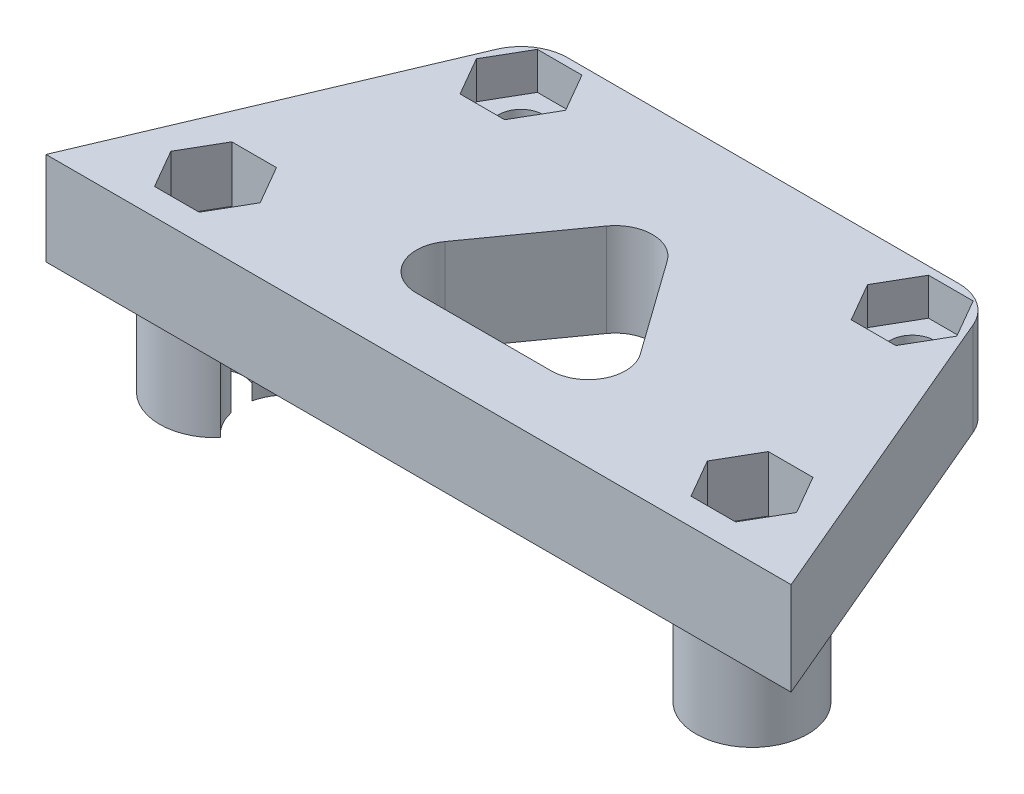
from build123d import *

# Parameters (mm, degrees)
SKETCH1_R            = 1.5
BOSS_EXTRUDE1_DEPTH  = 5
M2_CLEARANCE_HOLE1_D = 2.4
FILLET1_R            = 2
BOSS_EXTRUDE2_START  = 5
BOSS_EXTRUDE2_DEPTH  = 5
CUT_EXTRUDE1_START   = -3
SKETCH5_R            = 1.5
CUT_EXTRUDE1_DEPTH   = 3
CUT_EXTRUDE2_START   = -2
SKETCH6_R            = 1.2
CUT_EXTRUDE2_DEPTH   = 2


with BuildPart() as part:
    # Sketch1 → Boss-Extrude1 (new body)
    with BuildSketch(Plane(origin=(0, 0, 0), x_dir=(1, 0, 0), z_dir=(0, 1, 0))):
        with BuildLine():
            Line((10.5, 2.5), (-10.5, 2.5))
            ThreePointArc((-10.5, 2.5), (-11.880232595, 2.08445628), (-12.8016276, 0.975966388))
            Line((-12.8016276, 0.975966388), (-20, -16))
            Line((-20, -16), (20, -16))
            Line((20, -16), (12.8016276, 0.975966388))
            ThreePointArc((12.8016276, 0.975966388), (11.880232595, 2.08445628), (10.5, 2.5))
        make_face()
        with Locations((-14.4, -12.5)):
            Circle(SKETCH1_R, mode=Mode.SUBTRACT)
        with Locations((14.4, -12.5)):
            Circle(SKETCH1_R, mode=Mode.SUBTRACT)
        Polygon((-7.5, -12.5), (0, -2), (7.5, -12.5), align=None, mode=Mode.SUBTRACT)
    extrude(amount=BOSS_EXTRUDE1_DEPTH)

    # M2 Clearance Hole1 (through all)
    with Locations(Plane(origin=(0, 5, 0), x_dir=(1, 0, 0), z_dir=(0, 1, 0))):
        with Locations((-10.5, 0), (10.5, 0)):
            Hole(M2_CLEARANCE_HOLE1_D / 2)

    # Fillet1
    fillet1_edges = [part.edges().sort_by_distance(p)[0] for p in [
        (7.5, 2.5, 12.5),
        (-7.5, 2.5, 12.5),
        (0, 2.5, 2),
    ]]
    fillet(fillet1_edges, radius=FILLET1_R)

    # Sketch4 → Boss-Extrude2 (add)
    with BuildSketch(Plane.XZ.offset(BOSS_EXTRUDE2_START)):
        with BuildLine():
            ThreePointArc((13.01161859, 11.932199807), (12.695571974, 11.154604627), (12.146233974, 10.519964975))
            ThreePointArc((12.146233974, 10.519964975), (17.4, 12.5), (12.146233974, 14.480035025))
            ThreePointArc((12.146233974, 14.480035025), (12.695571974, 13.845395373), (13.01161859, 13.067800193))
            ThreePointArc((13.01161859, 13.067800193), (15.9, 12.5), (13.01161859, 11.932199807))
        make_face()
        with BuildLine():
            ThreePointArc((-13.01161859, 13.067800193), (-12.695571974, 13.845395373), (-12.146233974, 14.480035025))
            ThreePointArc((-12.146233974, 14.480035025), (-17.4, 12.5), (-12.146233974, 10.519964975))
            ThreePointArc((-12.146233974, 10.519964975), (-12.695571974, 11.154604627), (-13.01161859, 11.932199807))
            ThreePointArc((-13.01161859, 11.932199807), (-15.9, 12.5), (-13.01161859, 13.067800193))
        make_face()
    extrude(amount=-BOSS_EXTRUDE2_DEPTH)

    # Sketch5 → Cut-Extrude1 (cut)
    # profile 1 of 2: a face of its own
    with BuildSketch(Plane(origin=(0, 5, 0), x_dir=(1, 0, 0), z_dir=(0, 1, 0)).offset(CUT_EXTRUDE1_START)):
        Polygon((13.201998191, -14.575), (15.598001809, -14.575), (16.796003617, -12.5), (15.598001809, -10.425), (13.201998191, -10.425), (12.003996383, -12.5), align=None)
        with Locations((14.4, -12.5)):
            Circle(SKETCH5_R, mode=Mode.SUBTRACT)
    # profile 2 of 2: a face of its own
    with BuildSketch(Plane(origin=(0, 5, 0), x_dir=(1, 0, 0), z_dir=(0, 1, 0)).offset(CUT_EXTRUDE1_START)):
        Polygon((-12.003996383, -12.5), (-13.201998191, -14.575), (-15.598001809, -14.575), (-16.796003617, -12.5), (-15.598001809, -10.425), (-13.201998191, -10.425), align=None)
    extrude(amount=CUT_EXTRUDE1_DEPTH, mode=Mode.SUBTRACT)

    # Sketch6 → Cut-Extrude2 (cut)
    # profile 1 of 2: a face of its own
    with BuildSketch(Plane(origin=(0, 5, 0), x_dir=(1, 0, 0), z_dir=(0, 1, 0)).offset(CUT_EXTRUDE2_START)):
        Polygon((9.301998191, -2.075), (11.698001809, -2.075), (12.896003617, 0), (11.698001809, 2.075), (9.301998191, 2.075), (8.103996383, 0), align=None)
        with Locations((10.5, 0)):
            Circle(SKETCH6_R, mode=Mode.SUBTRACT)
    # profile 2 of 2: a face of its own
    with BuildSketch(Plane(origin=(0, 5, 0), x_dir=(1, 0, 0), z_dir=(0, 1, 0)).offset(CUT_EXTRUDE2_START)):
        Polygon((-8.103996383, 0), (-9.301998191, -2.075), (-11.698001809, -2.075), (-12.896003617, 0), (-11.698001809, 2.075), (-9.301998191, 2.075), align=None)
    extrude(amount=CUT_EXTRUDE2_DEPTH, mode=Mode.SUBTRACT)


solid = part.part
